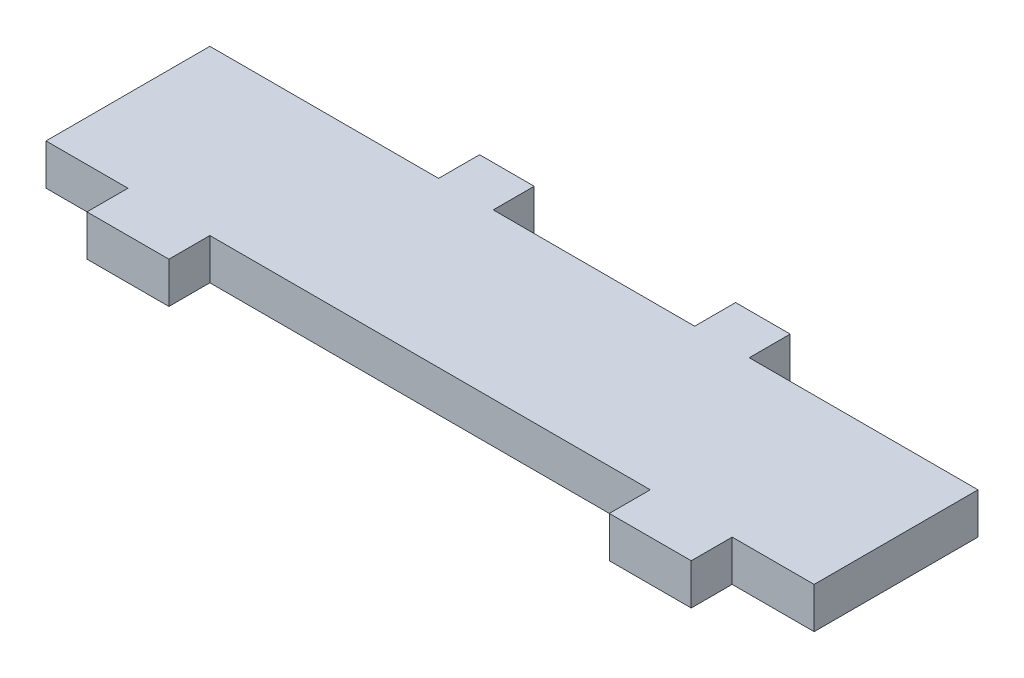
from build123d import *

# Parameters (mm, degrees)
SKETCH1_W           = 112.5
SKETCH1_H           = 24
BOSS_EXTRUDE1_DEPTH = 6
SKETCH2_W           = 8
SKETCH2_H           = 6
BOSS_EXTRUDE2_DEPTH = 6
SKETCH3_W           = 12
SKETCH3_H           = 6
BOSS_EXTRUDE3_DEPTH = 6


with BuildPart() as part:
    # Sketch1 → Boss-Extrude1 (new body)
    with BuildSketch(Plane(origin=(0, 0, 0), x_dir=(1, 0, 0), z_dir=(0, 1, 0))):
        Rectangle(SKETCH1_W, SKETCH1_H)
    extrude(amount=BOSS_EXTRUDE1_DEPTH)

    # Sketch2 → Boss-Extrude2 (add)
    with BuildSketch(Plane(origin=(0, 0, -12), x_dir=(-1, 0, 0), z_dir=(0, 0, -1))):
        with Locations((18.75, 3)):
            Rectangle(SKETCH2_W, SKETCH2_H)
        with Locations((-18.75, 3)):
            Rectangle(SKETCH2_W, SKETCH2_H)
    extrude(amount=BOSS_EXTRUDE2_DEPTH)

    # Sketch3 → Boss-Extrude3 (add)
    with BuildSketch(Plane.XY.offset(12)):
        with Locations((-38.25, 3)):
            Rectangle(SKETCH3_W, SKETCH3_H)
        with Locations((38.25, 3)):
            Rectangle(SKETCH3_W, SKETCH3_H)
    extrude(amount=BOSS_EXTRUDE3_DEPTH)


solid = part.part
